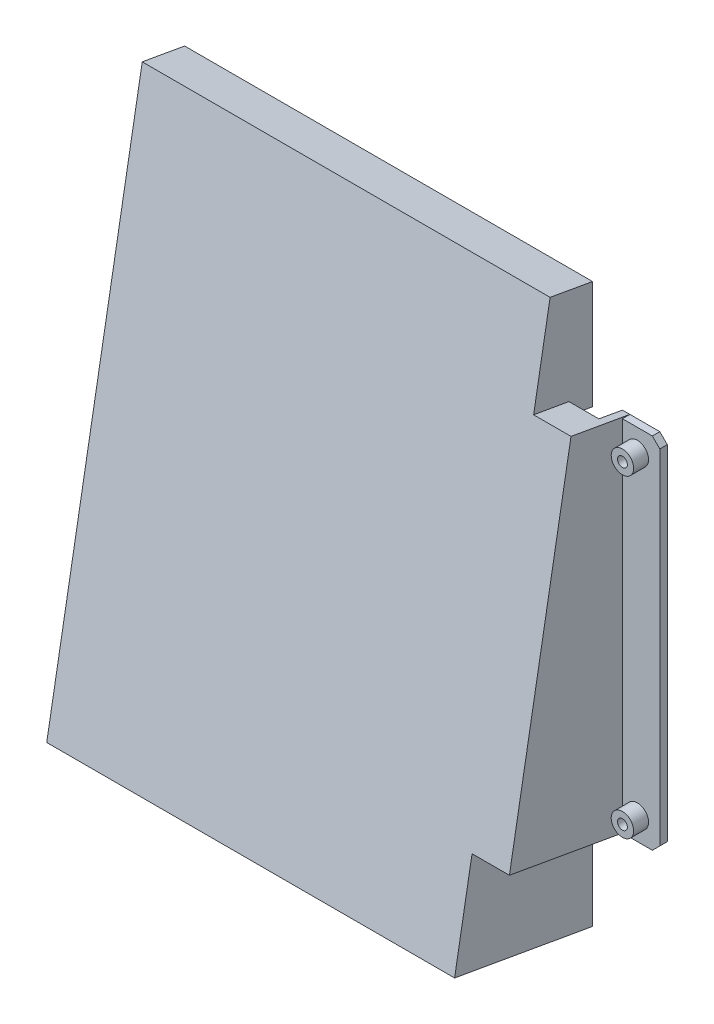
from build123d import *

# Parameters (mm, degrees)
SKETCH1_W                          = 9.525
SKETCH1_H                          = 76.2
BOSS_EXTRUDE1_DEPTH                = 1.5875
CHAMFER2_SIZE                      = 1.5875
F_97_0_0825_DIAMETER_HOLE1_D       = 2.0955
SKETCH5_R                          = 2.38125
SKETCH5_R_2                        = 1.04775
BOSS_EXTRUDE2_DEPTH                = 3.175
BOSS_EXTRUDE4_REACH                = 77.644
SKETCH7_W                          = 1.5875
SKETCH7_H                          = 75.318017262
BOSS_EXTRUDE4_DIRECTION_2_DEPTH    = 12.7
CUT_EXTRUDE1_DEPTH                 = 83.855524788
BOSS_EXTRUDE5_DEPTH                = 8.89
BOSS_EXTRUDE7_DEPTH                = 2.54
BOSS_EXTRUDE11_DEPTH               = 2.54
BOSS_EXTRUDE8_DEPTH                = 84.074
BOSS_EXTRUDE12_REACH               = 143.095
SKETCH18_W                         = 2.54
SKETCH18_H                         = 111.72801717
CUT_EXTRUDE2_DEPTH                 = 160.515381323
CUT_EXTRUDE2_DEPTH_BACK            = 2.54
SKETCH19_W                         = 61.214
SKETCH19_H                         = 12.7
SKETCH20_W                         = 10.16
SKETCH20_H                         = 10.16
BOSS_EXTRUDE13_DEPTH               = 5.08
CUT_EXTRUDE3_DEPTH                 = 128.89819871
CUT_EXTRUDE3_DEPTH_BACK            = 128.89819871
F_97_0_14_DIAMETER_HOLE1_OUTLINE_R = 1.778
F_97_0_14_DIAMETER_HOLE1_DEPTH     = 5.08
CUT_EXTRUDE4_DEPTH                 = 1.27


# Read off the part's stored shape, not the designer's step: #97 (0.14) Diameter Hole1
with BuildPart() as part:
    # Sketch1 → Boss-Extrude1 (new body)
    with BuildSketch(Plane.XY):
        with Locations((-4.7625, 38.1)):
            Rectangle(SKETCH1_W, SKETCH1_H)
    extrude(amount=BOSS_EXTRUDE1_DEPTH)

    # Chamfer2
    chamfer2_edges = [part.edges().sort_by_distance(p)[0] for p in [
        (0, 0, 0.79375),
        (-9.525, 0, 0.79375),
        (-9.525, 76.2, 0.79375),
        (0, 76.2, 0.79375),
    ]]
    chamfer(chamfer2_edges, length=CHAMFER2_SIZE)

    # #97 (0.0825) Diameter Hole1 (through all)
    with Locations(Plane.XY.offset(1.5875)):
        with Locations((-4.7625, 4.7625), (-4.7625, 71.4375)):
            Hole(F_97_0_0825_DIAMETER_HOLE1_D / 2)

    # Sketch5 → Boss-Extrude2 (add)
    # profile 1 of 2: a face of its own
    with BuildSketch(Plane.XY.offset(1.5875)):
        with Locations((-4.7625, 4.7625)):
            Circle(SKETCH5_R)
        with Locations((-4.7625, 4.7625)):
            Circle(SKETCH5_R_2, mode=Mode.SUBTRACT)
    # profile 2 of 2: a face of its own
    with BuildSketch(Plane.XY.offset(1.5875)):
        with Locations(Location((-4.7625, 71.4375, 0), (0, 0, 180))):
            Circle(SKETCH5_R)
        with Locations((-4.7625, 71.4375)):
            Circle(SKETCH5_R_2, mode=Mode.SUBTRACT)
    extrude(amount=BOSS_EXTRUDE2_DEPTH)

    # Boss-Extrude4: up to this face of the body (flat: up to its plane)
    boss_extrude4_end = Plane(part.part.faces().sort_by_distance((-4.7625, 38.1, 0))[0])
    # Sketch7 → Boss-Extrude4 (add, up to the picked face)
    with BuildSketch(Plane(origin=(0, 2.297711148, 13.030967461), x_dir=(-1, 0, 0), z_dir=(0, -0.1736481776669307, -0.984807753012208)), mode=Mode.PRIVATE) as boss_extrude4_sk1:
        with Locations((8.73125, 37.383342149)):
            Rectangle(SKETCH7_W, SKETCH7_H)
    boss_extrude4_tool1 = split(extrude(boss_extrude4_sk1.sketch, amount=BOSS_EXTRUDE4_REACH, mode=Mode.PRIVATE), bisect_by=boss_extrude4_end, keep=Keep.BOTH, mode=Mode.PRIVATE)
    add(boss_extrude4_tool1.solids().sort_by(Axis((-8.73125, 39.113116, 6.539418), (0, -0.1736481776669307, -0.984807753012208)))[0])

    # Sketch7 → Boss-Extrude4 direction 2 (add)
    with BuildSketch(Plane(origin=(0, 2.297711148, 13.030967461), x_dir=(-1, 0, 0), z_dir=(0, -0.1736481776669307, -0.984807753012208))):
        with Locations((8.73125, 37.383342149)):
            Rectangle(SKETCH7_W, SKETCH7_H)
    extrude(amount=-BOSS_EXTRUDE4_DIRECTION_2_DEPTH)

    # Sketch9 → Cut-Extrude1 (cut, through all)
    with BuildSketch(Plane(origin=(-7.9375, 0, 0), x_dir=(0, 0, -1), z_dir=(1, 0, 0))):
        Polygon((0, 0), (-1.5875, 0), (0, -0.279919082), align=None)
    extrude(amount=-CUT_EXTRUDE1_DEPTH, mode=Mode.SUBTRACT)

    # Sketch10 → Boss-Extrude5 (add)
    with BuildSketch(Plane.ZY.offset(9.525)):
        Polygon((25.585894906, 4.231564516), (12.507058463, 78.405331856), (5.002823385, 77.082132743), (5.443889757, 74.58072105), (10.446713142, 75.462853792), (22.643416842, 6.291909837), (7.39996286, 3.604077621), (7.841029232, 1.102665928), align=None)
    extrude(amount=BOSS_EXTRUDE5_DEPTH)

    # Sketch12 → Boss-Extrude7 (add)
    with BuildSketch(Plane.ZY.offset(18.415)):
        Polygon((25.144828535, 6.732976208), (29.28981052, -16.774384765), (0, -21.93896862), (0, 2.299264512), align=None)
    extrude(amount=-BOSS_EXTRUDE7_DEPTH)

    # Sketch17 → Boss-Extrude11 (add)
    with BuildSketch(Plane.ZY.offset(18.415)):
        Polygon((12.948124835, 75.903920164), (0, 73.620816406), (0, 96.671000496), (9.006311201, 98.259056157), align=None)
    extrude(amount=-BOSS_EXTRUDE11_DEPTH)

    # Sketch13 → Boss-Extrude8 (add)
    with BuildSketch(Plane.ZY.offset(18.415)):
        Polygon((9.006311201, 98.259056157), (0, 96.671000496), (0, 94.091816901), (6.94596588, 95.316578093), (26.347332456, -14.714039444), (0, -19.359785026), (0, -21.93896862), (29.28981052, -16.774384765), align=None)
    extrude(amount=BOSS_EXTRUDE8_DEPTH)

    # Boss-Extrude12: up to this plane
    boss_extrude12_end = Plane(origin=(-15.875, 2.299264512, 0), z_dir=(0, 0, -1))
    # Sketch18 → Boss-Extrude12 (add, up to the surface)
    with BuildSketch(Plane(origin=(0, 4.061976633, 23.036614231), x_dir=(-1, 0, 0), z_dir=(0, -0.17364817766693072, -0.9848077530122081)), mode=Mode.PRIVATE) as boss_extrude12_sk1:
        with Locations((101.219, 36.798342195)):
            Rectangle(SKETCH18_W, SKETCH18_H)
    boss_extrude12_tool1 = split(extrude(boss_extrude12_sk1.sketch, amount=BOSS_EXTRUDE12_REACH, mode=Mode.PRIVATE), bisect_by=boss_extrude12_end, keep=Keep.BOTH, mode=Mode.PRIVATE)
    add(boss_extrude12_tool1.solids().sort_by_distance((-101.219, 40.301269, 16.646649))[0])

    # Sketch19 → Cut-Extrude2 (cut, two sides: drawn at the far end of the back side and taken through both)
    with BuildSketch(Plane(origin=(0, -21.27742777, 3.751784596), x_dir=(-1, 0, 0), z_dir=(0, -0.984807753012208, 0.17364817766693108)).offset(-CUT_EXTRUDE2_DEPTH_BACK)):
        with Locations((59.182, -11.961991138)):
            Rectangle(SKETCH19_W, SKETCH19_H)
    extrude(amount=CUT_EXTRUDE2_DEPTH + CUT_EXTRUDE2_DEPTH_BACK, mode=Mode.SUBTRACT)

    # Sketch20 → Boss-Extrude13 (add)
    with BuildSketch(Plane(origin=(0, 0, 0), x_dir=(-1, 0, 0), z_dir=(0, 0, -1))):
        with Locations((97.409, -16.85896862)):
            Rectangle(SKETCH20_W, SKETCH20_H)
        with Locations((20.955, -16.85896862)):
            Rectangle(SKETCH20_W, SKETCH20_H)
        with Locations((20.955, 91.591000496)):
            Rectangle(SKETCH20_W, SKETCH20_H)
        with Locations((97.409, 91.591000496)):
            Rectangle(SKETCH20_W, SKETCH20_H)
    extrude(amount=-BOSS_EXTRUDE13_DEPTH)

    # Sketch21 → Cut-Extrude3 (cut, two sides: drawn at the far end of the back side and taken through both)
    with BuildSketch(Plane.ZY.offset(26.035).offset(-CUT_EXTRUDE3_DEPTH_BACK)):
        Polygon((0, -21.93896862), (5.08, -21.043227558), (5.08, -21.93896862), align=None)
    extrude(amount=CUT_EXTRUDE3_DEPTH + CUT_EXTRUDE3_DEPTH_BACK, mode=Mode.SUBTRACT)

    # #97 (0.14) Diameter Hole1 outline → #97 (0.14) Diameter Hole1 (cut)
    with BuildSketch(Plane.XY):
        with Locations((-97.409, 91.591000496)):
            Circle(F_97_0_14_DIAMETER_HOLE1_OUTLINE_R)
        with Locations((-20.955, 91.591000496)):
            Circle(F_97_0_14_DIAMETER_HOLE1_OUTLINE_R)
        with Locations((-97.409, -16.85896862)):
            Circle(F_97_0_14_DIAMETER_HOLE1_OUTLINE_R)
    extrude(amount=F_97_0_14_DIAMETER_HOLE1_DEPTH, mode=Mode.SUBTRACT)

    # 97 _0.14_ Diameter Hole1 2 outline → 97 _0.14_ Diameter Hole1 2 (revolve, cut)
    with BuildSketch(Plane(origin=(-20.955, -16.85896862, 0), x_dir=(1, 0, 0), z_dir=(0, -1, 0))):
        Polygon((0, 0), (1.778000002, 0), (1.778, 5.08), (1.584438765, 5.196303323), (0, 5.196303323), align=None)
    revolve(axis=Axis((-20.955, -16.85896862, 0), (0, 0, 1)), mode=Mode.SUBTRACT)

    # Sketch24 → Cut-Extrude4 (cut)
    with BuildSketch(Plane(origin=(-92.329, 0, 0), x_dir=(0, 0, -1), z_dir=(1, 0, 0))):
        Polygon((0, -19.359785026), (-5.08, -18.464043964), (-5.08, -11.77896862), (0, -11.77896862), align=None)
    extrude(amount=-CUT_EXTRUDE4_DEPTH, mode=Mode.SUBTRACT)


solid = part.part
